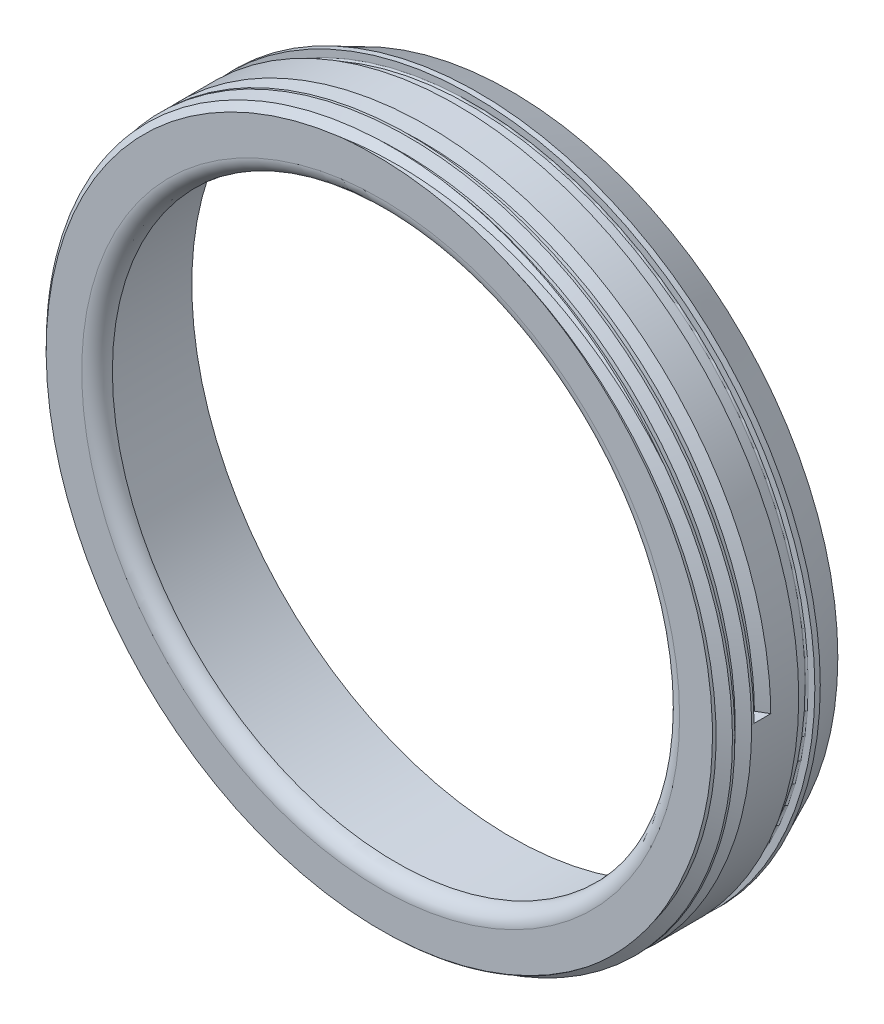
from build123d import *

# Parameters (mm, degrees)
SKETCH1_R           = 56.6928
SKETCH1_R_2         = 52.8828
BOSS_EXTRUDE1_DEPTH = 6.35
SKETCH3_R           = 55.3339
SKETCH3_R_2         = 52.8828
BOSS_EXTRUDE2_DEPTH = 2.667
SKETCH4_R           = 56.6928
SKETCH4_R_2         = 52.8828
BOSS_EXTRUDE3_DEPTH = 10.033
SKETCH18_R          = 56.6928
SKETCH18_R_2        = 46.99
BOSS_EXTRUDE4_DEPTH = 2.54
FILLET1_R           = 0.254
THREAD1_PITCH       = 3.175
FILLET2_R           = 2.54
CHAMFER2_SIZE       = 2.54
CHAMFER2_SIZE2      = 5.447047578


with BuildPart() as part:
    # Sketch1 → Boss-Extrude1 (new body)
    with BuildSketch(Plane.XY):
        with Locations((-54.462846348, 14.706120018)):
            Circle(SKETCH1_R)
        with Locations((-54.462846348, 14.706120018)):
            Circle(SKETCH1_R_2, mode=Mode.SUBTRACT)
    extrude(amount=BOSS_EXTRUDE1_DEPTH)

    # Sketch3 → Boss-Extrude2 (add)
    with BuildSketch(Plane.XY.offset(6.35)):
        with Locations((-54.462846348, 14.706120018)):
            Circle(SKETCH3_R)
        with Locations((-54.462846348, 14.706120018)):
            Circle(SKETCH3_R_2, mode=Mode.SUBTRACT)
    extrude(amount=BOSS_EXTRUDE2_DEPTH)

    # Sketch4 → Boss-Extrude3 (add)
    with BuildSketch(Plane.XY.offset(9.017)):
        with Locations((-54.462846348, 14.706120018)):
            Circle(SKETCH4_R)
        with Locations((-54.462846348, 14.706120018)):
            Circle(SKETCH4_R_2, mode=Mode.SUBTRACT)
    extrude(amount=BOSS_EXTRUDE3_DEPTH)

    # Sketch18 → Boss-Extrude4 (add)
    with BuildSketch(Plane.XY.offset(19.05)):
        with Locations((-54.462846348, 14.706120018)):
            Circle(SKETCH18_R)
        with Locations((-54.462846348, 14.706120018)):
            Circle(SKETCH18_R_2, mode=Mode.SUBTRACT)
    extrude(amount=BOSS_EXTRUDE4_DEPTH)

    # Fillet1
    fillet1_edges = [part.edges().sort_by_distance(p)[0] for p in [
        (-109.796746348, 14.706120018, 9.017),
        (-109.796746348, 14.706120018, 6.35),
    ]]
    fillet(fillet1_edges, radius=FILLET1_R)

    # Thread1: arcs per turn and ends read off the stored shape
    # Thread1: the profile of Thread Profile2 profile screwed along a right-hand helix through 2.5 turns, 12 arcs to a turn; built about Z, then put on its axis
    thread1_z = Axis((0, 0, 0), (0, 0, 1))
    thread1_corners = [(-56.6931, 0, -7.937673205), (-56.6931, 0, -5.159201804), (-54.974280846, 0, -6.151562504), (-54.974280846, 0, -6.945312504)]
    with BuildLine(mode=Mode.PRIVATE) as thread1_profile:
        Line(thread1_corners[0], thread1_corners[1])
        Line(thread1_corners[1], thread1_corners[2])
        Line(thread1_corners[2], thread1_corners[3])
        Line(thread1_corners[3], thread1_corners[0])
    thread1_cap = Face(thread1_profile.wire())
    thread1_turn_angles = [0, 15, 30, 45, 60, 75, 90, 105, 120, 135, 150, 165, 180, 195, 210, 225, 240, 255, 270, 285, 300, 315, 330, 345, 360]
    thread1_turn_weights = [1, 0.9659258262890683, 1, 0.9659258262890683, 1, 0.9659258262890683, 1, 0.9659258262890683, 1, 0.9659258262890683, 1, 0.9659258262890683, 1, 0.9659258262890683, 1, 0.9659258262890683, 1, 0.9659258262890683, 1, 0.9659258262890683, 1, 0.9659258262890683, 1, 0.9659258262890683, 1]
    thread1_turn_rails = [Edge.make_bspline([Vector(p[0], p[1], 0).rotate(thread1_z, thread1_turn_angles[k]) / thread1_turn_weights[k] + Vector(0, 0, p[2] + THREAD1_PITCH * thread1_turn_angles[k] / 360) for k in range(25)], [0, 0, 0, 1, 1, 2, 2, 3, 3, 4, 4, 5, 5, 6, 6, 7, 7, 8, 8, 9, 9, 10, 10, 11, 11, 12, 12, 12], 2, thread1_turn_weights) for p in thread1_corners]
    thread1_turn_sides = [Face.make_surface_from_curves(thread1_turn_rails[p[0]], thread1_turn_rails[p[1]]) for p in [(0, 1), (1, 2), (2, 3), (3, 0)]]
    thread1_last_angles = [720, 735, 750, 765, 780, 795, 810, 825, 840, 855, 870, 885, 900]
    thread1_last_weights = [1, 0.9659258262890683, 1, 0.9659258262890683, 1, 0.9659258262890683, 1, 0.9659258262890683, 1, 0.9659258262890683, 1, 0.9659258262890683, 1]
    thread1_last_rails = [Edge.make_bspline([Vector(p[0], p[1], 0).rotate(thread1_z, thread1_last_angles[k]) / thread1_last_weights[k] + Vector(0, 0, p[2] + THREAD1_PITCH * thread1_last_angles[k] / 360) for k in range(13)], [0, 0, 0, 1, 1, 2, 2, 3, 3, 4, 4, 5, 5, 6, 6, 6], 2, thread1_last_weights) for p in thread1_corners]
    thread1_last_sides = [Face.make_surface_from_curves(thread1_last_rails[p[0]], thread1_last_rails[p[1]]) for p in [(0, 1), (1, 2), (2, 3), (3, 0)]]
    thread1 = Plane(origin=(-54.462846348, 14.706120018, 21.59), x_dir=(-1, 0, 0), z_dir=(0, 0, 1)) * Solid(Shell([*[p.moved(Location((0, 0, THREAD1_PITCH * i))) for i in range(2) for p in thread1_turn_sides], *thread1_last_sides, thread1_cap, thread1_cap.rotate(thread1_z, 900).moved(Location((0, 0, THREAD1_PITCH * 900 / 360)))]))
    add(thread1, mode=Mode.SUBTRACT)

    # Chamfer1: read off the stored shape, not the designer's step
    # Chamfer1 outline → Chamfer1 (revolve, cut)
    with BuildSketch(Plane(origin=(-54.462846348, 14.706120018, 0), x_dir=(1, 0, 0), z_dir=(0, -1, 0))):
        Polygon((56.6928, 21.59), (55.4228, 21.59), (56.6928, 20.32), align=None)
    revolve(axis=Axis((-54.462846348, 14.706120018, 0), (0, 0, 1)), mode=Mode.SUBTRACT)

    # Fillet2
    fillet2_edges = [part.edges().sort_by_distance(p)[0] for p in [
        (-101.452846348, 14.706120018, 21.59),
    ]]
    fillet(fillet2_edges, radius=FILLET2_R - 0.0001)  # a hair under: the kernel refuses the full size

    # Chamfer2
    chamfer2_edges = [part.edges().sort_by_distance(p)[0] for p in [
        (-111.155646348, 14.706120018, 0),
    ]]
    chamfer2_side = [part.faces().sort_by_distance(p)[0] for p in [
        (-109.552131815, 14.706120018, 0),
    ]]
    chamfer(chamfer2_edges, length=CHAMFER2_SIZE, length2=CHAMFER2_SIZE2, reference=chamfer2_side[0])


solid = part.part
